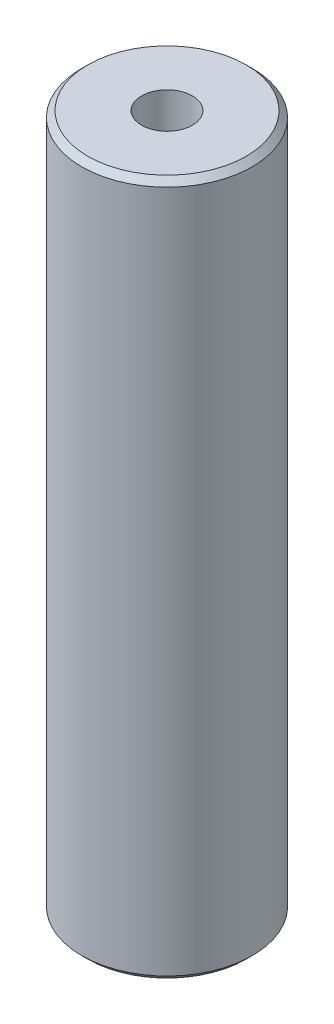
from build123d import *

# Parameters (mm, degrees)
SKETCH1_R           = 50
BOSS_EXTRUDE1_DEPTH = 407.629747169
SKETCH2_R           = 14.905298319
CUT_EXTRUDE1_DEPTH  = 414.717307805
CHAMFER1_SIZE       = 3.573596082


with BuildPart() as part:
    # Sketch1 → Boss-Extrude1 (new body)
    with BuildSketch(Plane(origin=(0, 0, 0), x_dir=(1, 0, 0), z_dir=(0, 1, 0))):
        Circle(SKETCH1_R)
    extrude(amount=BOSS_EXTRUDE1_DEPTH)

    # Sketch2 → Cut-Extrude1 (cut, through all)
    with BuildSketch(Plane(origin=(0, 0, 0), x_dir=(1, 0, 0), z_dir=(0, 1, 0))):
        Circle(SKETCH2_R)
    extrude(amount=CUT_EXTRUDE1_DEPTH, mode=Mode.SUBTRACT)

    # Chamfer1
    chamfer1_edges = [part.edges().sort_by_distance(p)[0] for p in [
        (-50, 407.629747169, 0),
        (-50, 0, 0),
    ]]
    chamfer(chamfer1_edges, length=CHAMFER1_SIZE)


solid = part.part
